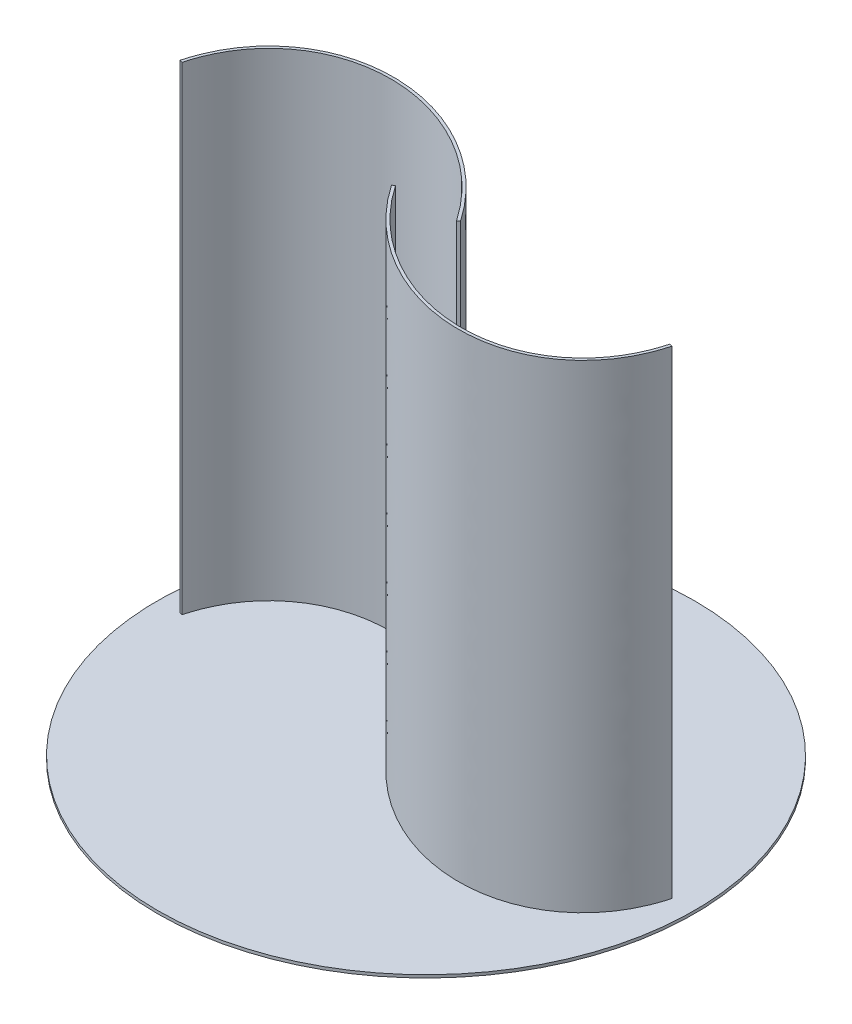
from build123d import *

# Parameters (mm, degrees)
EXTRUIR_L_MINA1_DEPTH      = 500
CROQUIS2_R                 = 280.5
SALIENTE_EXTRUIR8_DEPTH    = 3
S_LIDO_MOVER_COPIAR1_ANGLE = 90
S_LIDO_MOVER_COPIAR4_ANGLE = 30
S_LIDO_MOVER_COPIAR5_ANGLE = 60


# Read off the part's stored shape, not the designer's step: Extruir-Lámina1
with BuildPart() as part:
    # Extruir-Lámina1 outline → Extruir-Lámina1 (new body)
    with BuildSketch(Plane(origin=(0, 0, 0), x_dir=(1, 0, 0), z_dir=(0, 1, 0))):
        with BuildLine():
            Line((31.875, 0), (34.356701928, 1.685572764))
            add(Edge.make_bspline(
                [(34.356701928, 1.685572764), (29.518040632, 8.809628945), (24.267823861, 15.685451155), (13.043122074, 28.811525887), (7.068700961, 35.06170371), (-5.492207392, 46.818666019), (-12.078623416, 52.325384088), (-25.740104245, 62.49116755), (-32.815092971, 67.150176271), (-47.321306209, 75.531697275), (-54.752452693, 79.254163139), (-69.831896112, 85.690717355), (-77.480116058, 88.404768596), (-92.850285291, 92.770822658), (-100.572160634, 94.422794798), (-115.944153653, 96.630233569), (-123.594199427, 97.185671477), (-138.67715966, 97.185671477), (-146.109997884, 96.630203371), (-160.615473741, 94.414982201), (-167.688019401, 92.755200875), (-181.334621667, 88.359806412), (-187.908561768, 85.624182586), (-200.427548629, 79.12807609), (-206.372461713, 75.367623458), (-217.514678219, 66.895150195), (-222.711858807, 62.183212028), (-232.255552381, 51.901710647), (-236.60198399, 46.332267049), (-244.359948455, 34.447233779), (-247.771449852, 28.131768977), (-253.595847098, 14.879916022), (-256.008745547, 7.943635207), (-257.900928696, 0.7645997)],
                knots=[0, 0, 0, 0, 0.0625, 0.0625, 0.125, 0.125, 0.1875, 0.1875, 0.25, 0.25, 0.3125, 0.3125, 0.375, 0.375, 0.4375, 0.4375, 0.5, 0.5, 0.5625, 0.5625, 0.625, 0.625, 0.6875, 0.6875, 0.75, 0.75, 0.8125, 0.8125, 0.875, 0.875, 0.9375, 0.9375, 1, 1, 1, 1], degree=3))
            Line((-257.900928696, 0.7645997), (-255, 0))
            add(Edge.make_bspline(
                [(31.875, 0), (-174.798302373, 304.28916746), (-255, 0)],
                knots=[4.585816309, 4.585816309, 4.585816309, 6.797723407, 6.797723407, 6.797723407], degree=2, weights=[1, 0.448282267, 1]))
        make_face()
        with BuildLine():
            Line((-31.875, 0), (-34.356701928, -1.685572764))
            add(Edge.make_bspline(
                [(-34.356701928, -1.685572764), (-29.518040632, -8.809628945), (-24.267823861, -15.685451155), (-13.043122074, -28.811525887), (-7.068700961, -35.06170371), (5.492207392, -46.818666019), (12.078623416, -52.325384088), (25.740104245, -62.49116755), (32.815092971, -67.150176271), (47.321306209, -75.531697275), (54.752452693, -79.254163139), (69.831896112, -85.690717355), (77.480116058, -88.404768596), (92.850285291, -92.770822658), (100.572160634, -94.422794798), (115.944153653, -96.630233569), (123.594199427, -97.185671477), (138.67715966, -97.185671477), (146.109997884, -96.630203371), (160.615473741, -94.414982201), (167.688019401, -92.755200875), (181.334621667, -88.359806412), (187.908561768, -85.624182586), (200.427548629, -79.12807609), (206.372461713, -75.367623458), (217.514678219, -66.895150195), (222.711858807, -62.183212028), (232.255552381, -51.901710647), (236.60198399, -46.332267049), (244.359948455, -34.447233779), (247.771449852, -28.131768977), (253.595847098, -14.879916022), (256.008745547, -7.943635207), (257.900928696, -0.7645997)],
                knots=[0, 0, 0, 0, 0.0625, 0.0625, 0.125, 0.125, 0.1875, 0.1875, 0.25, 0.25, 0.3125, 0.3125, 0.375, 0.375, 0.4375, 0.4375, 0.5, 0.5, 0.5625, 0.5625, 0.625, 0.625, 0.6875, 0.6875, 0.75, 0.75, 0.8125, 0.8125, 0.875, 0.875, 0.9375, 0.9375, 1, 1, 1, 1], degree=3))
            Line((257.900928696, -0.7645997), (255, 0))
            add(Edge.make_bspline(
                [(-31.875, 0), (174.798302373, -304.289167461), (255, 0)],
                knots=[4.585816309, 4.585816309, 4.585816309, 6.797723407, 6.797723407, 6.797723407], degree=2, weights=[1, 0.448282267, 1]))
        make_face()
    extrude(amount=EXTRUIR_L_MINA1_DEPTH)

    # Croquis2 → Saliente-Extruir8 (add)
    with BuildSketch(Plane.XZ):
        with Locations(Location((0, 0, 0), (0, 0, 270))):
            Circle(CROQUIS2_R)
    extrude(amount=SALIENTE_EXTRUIR8_DEPTH)


with BuildPart() as part_1:
    # Sólido-Mover/Copiar1: moved
    add(part.part.rotate(Axis((0, 0, 0), (0, -1, 0)), S_LIDO_MOVER_COPIAR1_ANGLE))


with BuildPart() as part_2:
    # Sólido-Mover/Copiar4: moved
    add(part_1.part.rotate(Axis((0, 0, 0), (0, 1, 0)), S_LIDO_MOVER_COPIAR4_ANGLE))


with BuildPart() as part_3:
    # Sólido-Mover/Copiar5: moved
    add(part_2.part.rotate(Axis((0, 0, 0), (0, 1, 0)), S_LIDO_MOVER_COPIAR5_ANGLE))


solid = part_3.part
